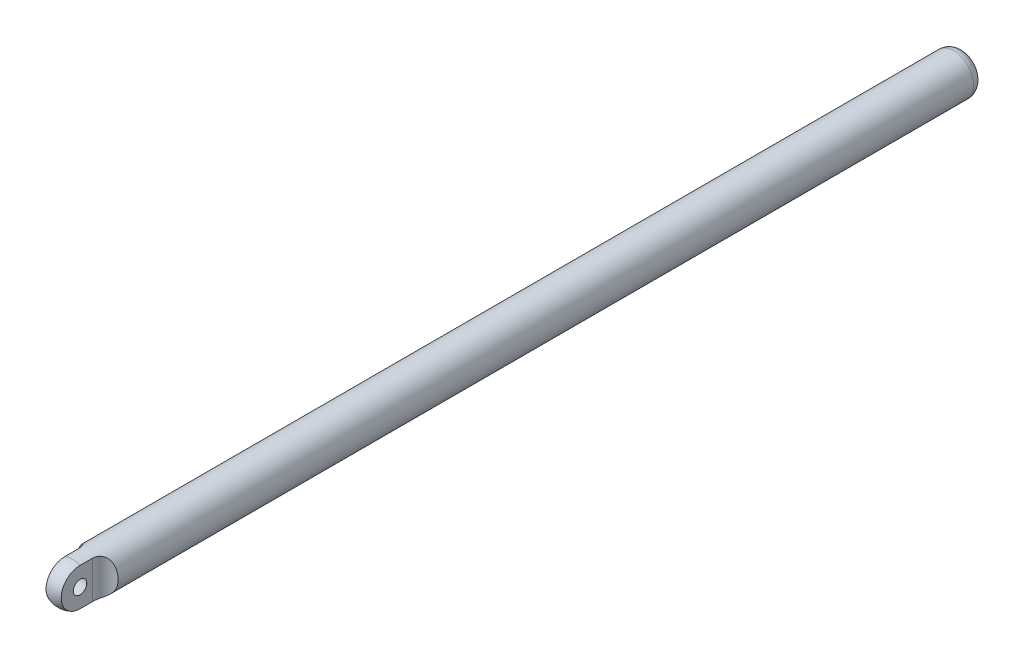
from build123d import *

# Parameters (mm, degrees)
SCHIZZO1_R                   = 8
ESTRUSIONE_ESTRUSIONE1_DEPTH = 351.1
RACCORDO3_R                  = 4
RIVOLUZIONE4_ANGLE           = 180
SCHIZZO7_W                   = 5
SCHIZZO7_H                   = 20
TAGLIO_ESTRUSIONE2_DEPTH     = 360.278179134
RACCORDO4_R                  = 5


with BuildPart() as part:
    # Schizzo1 → Estrusione-Estrusione1 (new body)
    with BuildSketch(Plane.XY):
        Circle(SCHIZZO1_R)
    extrude(amount=ESTRUSIONE_ESTRUSIONE1_DEPTH)


with BuildPart() as body_2:
    # Schizzo2 → Rivoluzione1 (revolve)
    with BuildSketch(Plane(origin=(0, 0, 0), x_dir=(1, 0, 0), z_dir=(0, 1, 0))):
        with BuildLine():
            Line((4, -1), (-4, -1))
            ThreePointArc((-4, -1), (0, -5), (4, -1))
        make_face()
    revolve(axis=Axis((4, 0, 1), (-1, 0, 0)))


with BuildPart() as part_1:
    add(part.part)

    # Abbina1: cut body 2
    add(body_2.part, mode=Mode.SUBTRACT)

    # Raccordo3
    raccordo3_edges = [part_1.edges().sort_by_distance(p)[0] for p in [
        (-8, 0, 0),
    ]]
    fillet(raccordo3_edges, radius=RACCORDO3_R)

    # Schizzo5 → Rivoluzione4 (revolve)
    with BuildSketch(Plane.XY.offset(351.1)):
        with BuildLine():
            Line((1.479642647, -7.861975429), (-1.479642647, 7.861975429))
            ThreePointArc((-1.479642647, 7.861975429), (7.861975429, 1.479642647), (1.479642647, -7.861975429))
        make_face()
    revolve(axis=Axis((1.479642647, -7.861975429, 351.1), (0.1849553308172722, -0.9827469285641515, 0)), revolution_arc=RIVOLUZIONE4_ANGLE)

    # Schizzo7 → Taglio-Estrusione2 (cut, symmetric)
    with BuildSketch(Plane(origin=(0, 0, 0), x_dir=(1, 0, 0), z_dir=(0, 1, 0))):
        with Locations((-5.5, -351.1)):
            Rectangle(SCHIZZO7_W, SCHIZZO7_H)
    taglio_estrusione2 = extrude(amount=TAGLIO_ESTRUSIONE2_DEPTH, both=True, mode=Mode.SUBTRACT)

    # Specchia2: Taglio-Estrusione2 across plane
    add(taglio_estrusione2.mirror(Plane(origin=(0, 0, 0), x_dir=(0, 0, 1), z_dir=(1, 0, 0))), mode=Mode.SUBTRACT)


with BuildPart() as body_2_2:
    # Schizzo8 → Rivoluzione6 (revolve)
    with BuildSketch(Plane.XY.offset(351.1)):
        with BuildLine():
            Line((4, 0), (-4, 0))
            ThreePointArc((-4, 0), (0, 4), (4, 0))
        make_face()
    revolve(axis=Axis((4, 0, 351.1), (-1, 0, 0)))


with BuildPart() as part_2:
    add(part_1.part)

    # Abbina2: cut body 2 2
    add(body_2_2.part, mode=Mode.SUBTRACT)

    # Raccordo4
    raccordo4_edges = [part_2.edges().sort_by_distance(p)[0] for p in [
        (3, 0, 341.1),
        (-3, 0, 341.1),
    ]]
    fillet(raccordo4_edges, radius=RACCORDO4_R - 0.0001)  # a hair under: the kernel refuses the full size


solid = part_2.part
